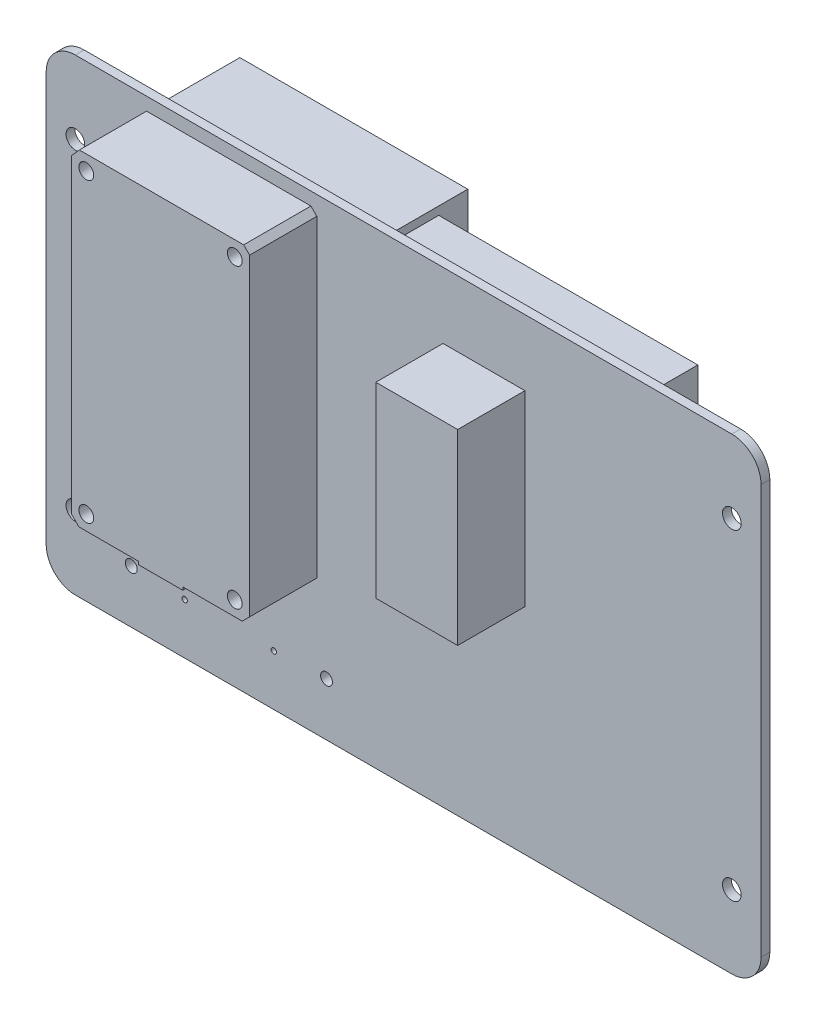
from build123d import *

# Parameters (mm, degrees)
EXTRUDE_4_OUTLINE_R  = 1.5999968
EXTRUDE_4_OUTLINE_W  = 44.323
EXTRUDE_4_OUTLINE_H  = 54.229
EXTRUDE_4_DEPTH      = 1.5
EXTRUDE_5_DEPTH      = 1.5
EXTRUDE_5_DEPTH_BACK = 13
SKETCH_3_W           = 44.323
SKETCH_3_H           = 54.229
SKETCH_5_R           = 1.27
SKETCH_5_W           = 14.0000228
SKETCH_5_H           = 32.0000376
EXTRUDE_6_DEPTH      = 13
EXTRUDE_8_DEPTH      = 1.5
EXTRUDE_8_DEPTH_BACK = 20
SKETCH_6_W           = 38.989
SKETCH_6_H           = 65.9999442
SKETCH_6_R           = 1.016
SKETCH_6_R_2         = 0.4572


# Read off the part's stored shape, not the designer's step: 凸台-拉伸4
with BuildPart() as part:
    # 凸台-拉伸4 outline → 凸台-拉伸4 (new body)
    with BuildSketch(Plane.XY):
        with BuildLine():
            ThreePointArc((122.299984025, 9.019649552), (120.835516371, 12.55516818), (117.299994025, 14.019626857))
            Line((117.299994025, 14.019626857), (4.999990016, 14.019626857))
            ThreePointArc((4.999990016, 14.019626857), (1.464472156, 12.555172669), (1.1e-08, 9.019662248))
            Line((1.1e-08, 9.019662248), (1.1e-08, -60.980388257))
            ThreePointArc((1.1e-08, -60.980388257), (1.464467665, -64.515906885), (4.999990011, -65.980365562))
            Line((4.999990011, -65.980365562), (117.29999402, -65.980365562))
            ThreePointArc((117.29999402, -65.980365562), (120.835516369, -64.515906884), (122.299984025, -60.980388255))
            Line((122.299984025, -60.980388255), (122.299984025, 9.019649552))
        make_face()
        with Locations((4.999990011, -53.480365152)):
            Circle(EXTRUDE_4_OUTLINE_R, mode=Mode.SUBTRACT)
        with Locations((117.299994011, -53.480365152)):
            Circle(EXTRUDE_4_OUTLINE_R, mode=Mode.SUBTRACT)
        Polygon((11.635994011, 6.209634848), (15.826994011, 6.209634848), (15.826994011, 10.273634848), (17.183354011, 11.797634848), (45.290994011, 11.797634848), (46.306994011, 10.781634848), (46.306994011, 6.209634848), (50.624994011, 6.209634848), (50.624994011, -59.790309352), (11.635994011, -59.790309352), align=None, mode=Mode.SUBTRACT)
        with Locations((4.999990011, 1.519524848)):
            Circle(EXTRUDE_4_OUTLINE_R, mode=Mode.SUBTRACT)
        with Locations((74.818494011, -20.269865152)):
            Rectangle(EXTRUDE_4_OUTLINE_W, EXTRUDE_4_OUTLINE_H, mode=Mode.SUBTRACT)
        with Locations((117.299994011, 1.519524848)):
            Circle(EXTRUDE_4_OUTLINE_R, mode=Mode.SUBTRACT)
    extrude(amount=EXTRUDE_4_DEPTH)



with BuildPart() as body_2:
    # 草图3 → 凸台-拉伸5 (new, two sides: drawn at the far end of the back side and taken through both)
    with BuildSketch(Plane.XY.offset(-EXTRUDE_5_DEPTH_BACK)):
        with Locations((74.818494011, -20.269865152)):
            Rectangle(SKETCH_3_W, SKETCH_3_H)
    extrude(amount=EXTRUDE_5_DEPTH + EXTRUDE_5_DEPTH_BACK)


with BuildPart() as part_1:
    add(part.part)

    add(body_2.part)  # 凸台-拉伸6 merges body 2
    # 草图5 → 凸台-拉伸6 (add)
    # profile 1 of 3: a face of its own
    with BuildSketch(Plane.XY):
        Polygon((46.306994011, 6.209634848), (15.826994011, 6.209634848), (15.826994011, -42.812365152), (17.096994011, -44.082365152), (27.256994011, -44.082365152), (27.256994011, -44.590365152), (34.876994011, -44.590365152), (34.876994011, -44.082365152), (45.036994011, -44.082365152), (46.306994011, -42.812365152), align=None)
        with Locations(Location((18.366994011, -41.542365152, 0), (0, 0, 180))):
            Circle(SKETCH_5_R, mode=Mode.SUBTRACT)
        with Locations(Location((43.766994011, -41.542365152, 0), (0, 0, 180))):
            Circle(SKETCH_5_R, mode=Mode.SUBTRACT)
    # profile 2 of 3: a face of its own
    with BuildSketch(Plane.XY):
        Polygon((15.826994011, 10.273634848), (15.826994011, 6.209634848), (46.306994011, 6.209634848), (46.306994011, 10.781634848), (45.290994011, 11.797634848), (38.686994011, 11.797634848), (23.446994011, 11.797634848), (17.183354011, 11.797634848), align=None)
        with Locations(Location((18.366994011, 9.257634848, 0), (0, 0, 180))):
            Circle(SKETCH_5_R, mode=Mode.SUBTRACT)
        with Locations(Location((43.766994011, 9.257634848, 0), (0, 0, 180))):
            Circle(SKETCH_5_R, mode=Mode.SUBTRACT)
    # profile 3 of 3: a face of its own
    with BuildSketch(Plane.XY):
        with Locations((74.897005411, -13.257382352)):
            Rectangle(SKETCH_5_W, SKETCH_5_H)
    extrude(amount=EXTRUDE_6_DEPTH)

    # 草图6 → 凸台-拉伸8 (add, two sides: drawn at the far end of the back side and taken through both)
    with BuildSketch(Plane.XY.offset(-EXTRUDE_8_DEPTH_BACK)):
        with Locations((31.130494011, -26.790337252)):
            Rectangle(SKETCH_6_W, SKETCH_6_H)
        with Locations((14.556994011, -56.909365152)):
            Circle(SKETCH_6_R, mode=Mode.SUBTRACT)
        with Locations((23.700994011, -57.290365152)):
            Circle(SKETCH_6_R_2, mode=Mode.SUBTRACT)
        with Locations((38.940994011, -57.290365152)):
            Circle(SKETCH_6_R_2, mode=Mode.SUBTRACT)
        with Locations((47.957994011, -56.909365152)):
            Circle(SKETCH_6_R, mode=Mode.SUBTRACT)
    extrude(amount=EXTRUDE_8_DEPTH + EXTRUDE_8_DEPTH_BACK)


solid = part_1.part
